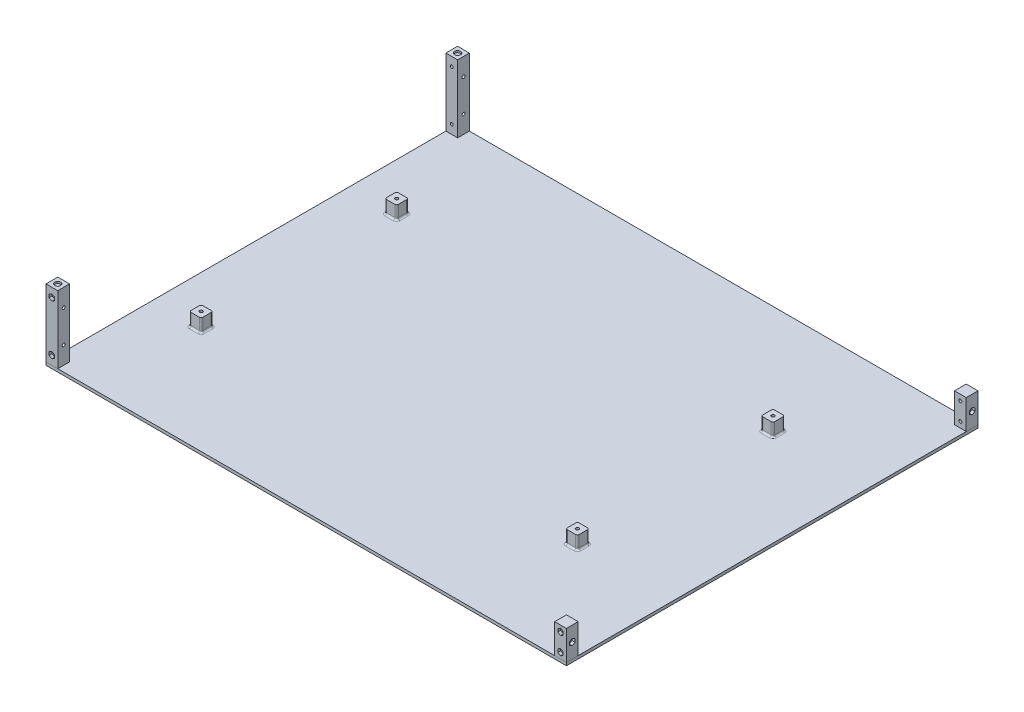
from build123d import *

# Parameters (mm, degrees)
SKETCH1_W            = 885
SKETCH1_H            = 700
BOSS_EXTRUDE1_DEPTH  = 5
SKETCH2_R            = 2.65
BOSS_EXTRUDE2_DEPTH  = 22.5
SKETCH4_R            = 5
CUT_EXTRUDE1_DEPTH   = 30
FILLET1_R            = 3
SKETCH5_W            = 20
SKETCH5_H            = 20
BOSS_EXTRUDE3_DEPTH  = 115
SKETCH6_W            = 20
SKETCH6_H            = 20
BOSS_EXTRUDE4_DEPTH  = 50
SKETCH7_R            = 2.5
CUT_EXTRUDE2_DEPTH   = 50
CUT_EXTRUDE3_START   = -5
SKETCH8_R            = 2.5
CUT_EXTRUDE3_DEPTH   = 5
LPATTERN1_COUNT      = 2
LPATTERN1_PITCH      = 55
LPATTERN2_COUNT      = 2
LPATTERN2_PITCH      = 680
LPATTERN2_COUNT_DIR2 = 2
LPATTERN2_PITCH_DIR2 = 55
CUT_EXTRUDE4_REACH   = 1136.736
SKETCH9_R            = 2.5
SKETCH10_R           = 2.5
CUT_EXTRUDE5_DEPTH   = 5
SKETCH11_R           = 2.65
CUT_EXTRUDE6_DEPTH   = 20
SKETCH12_R           = 2.65
CUT_EXTRUDE7_DEPTH   = 20
CUT_EXTRUDE8_DEPTH   = 5
CUT_EXTRUDE9_DEPTH   = 5
SKETCH15_R           = 5.1
CUT_EXTRUDE10_DEPTH  = 3.2


with BuildPart() as part:
    # Sketch1 → Boss-Extrude1 (new body)
    with BuildSketch(Plane(origin=(0, 0, 0), x_dir=(1, 0, 0), z_dir=(0, 1, 0))):
        with Locations((442.5, 350)):
            Rectangle(SKETCH1_W, SKETCH1_H)
    extrude(amount=BOSS_EXTRUDE1_DEPTH)

    # Sketch2 → Boss-Extrude2 (add)
    # profile 1 of 4: a face of its own
    with BuildSketch(Plane(origin=(0, 5, 0), x_dir=(1, 0, 0), z_dir=(0, 1, 0))):
        with BuildLine():
            Line((710, 523.25), (710, 509.25))
            ThreePointArc((710, 509.25), (710.878679656, 507.128679656), (713, 506.25))
            Line((713, 506.25), (727, 506.25))
            ThreePointArc((727, 506.25), (729.121320344, 507.128679656), (730, 509.25))
            Line((730, 509.25), (730, 523.25))
            ThreePointArc((730, 523.25), (729.121320344, 525.371320344), (727, 526.25))
            Line((727, 526.25), (713, 526.25))
            ThreePointArc((713, 526.25), (710.878679656, 525.371320344), (710, 523.25))
        make_face()
        with Locations((720, 516.25)):
            Circle(SKETCH2_R, mode=Mode.SUBTRACT)
    # profile 2 of 4: a face of its own
    with BuildSketch(Plane(origin=(0, 5, 0), x_dir=(1, 0, 0), z_dir=(0, 1, 0))):
        with BuildLine():
            Line((727, 193.75), (720, 193.75))
            Line((720, 193.75), (713, 193.75))
            ThreePointArc((713, 193.75), (710.878679656, 192.871320344), (710, 190.75))
            Line((710, 190.75), (710, 176.75))
            ThreePointArc((710, 176.75), (710.878679656, 174.628679656), (713, 173.75))
            Line((713, 173.75), (727, 173.75))
            ThreePointArc((727, 173.75), (729.121320344, 174.628679656), (730, 176.75))
            Line((730, 176.75), (730, 190.75))
            ThreePointArc((730, 190.75), (729.121320344, 192.871320344), (727, 193.75))
        make_face()
        with Locations((720, 183.75)):
            Circle(SKETCH2_R, mode=Mode.SUBTRACT)
    # profile 3 of 4: a face of its own
    with BuildSketch(Plane(origin=(0, 5, 0), x_dir=(1, 0, 0), z_dir=(0, 1, 0))):
        with BuildLine():
            Line((87, 193.75), (80, 193.75))
            Line((80, 193.75), (73, 193.75))
            ThreePointArc((73, 193.75), (70.878679656, 192.871320344), (70, 190.75))
            Line((70, 190.75), (70, 176.75))
            ThreePointArc((70, 176.75), (70.878679656, 174.628679656), (73, 173.75))
            Line((73, 173.75), (87, 173.75))
            ThreePointArc((87, 173.75), (89.121320344, 174.628679656), (90, 176.75))
            Line((90, 176.75), (90, 190.75))
            ThreePointArc((90, 190.75), (89.121320344, 192.871320344), (87, 193.75))
        make_face()
        with Locations((80, 183.75)):
            Circle(SKETCH2_R, mode=Mode.SUBTRACT)
    # profile 4 of 4: a face of its own
    with BuildSketch(Plane(origin=(0, 5, 0), x_dir=(1, 0, 0), z_dir=(0, 1, 0))):
        with BuildLine():
            Line((90, 509.25), (90, 523.25))
            ThreePointArc((90, 523.25), (89.121320344, 525.371320344), (87, 526.25))
            Line((87, 526.25), (73, 526.25))
            ThreePointArc((73, 526.25), (70.878679656, 525.371320344), (70, 523.25))
            Line((70, 523.25), (70, 509.25))
            ThreePointArc((70, 509.25), (70.878679656, 507.128679656), (73, 506.25))
            Line((73, 506.25), (87, 506.25))
            ThreePointArc((87, 506.25), (89.121320344, 507.128679656), (90, 509.25))
        make_face()
        with Locations((80, 516.25)):
            Circle(SKETCH2_R, mode=Mode.SUBTRACT)
    extrude(amount=BOSS_EXTRUDE2_DEPTH)

    # Sketch4 → Cut-Extrude1 (cut)
    with BuildSketch(Plane(origin=(0, 5, 0), x_dir=(1, 0, 0), z_dir=(0, 1, 0))):
        with Locations((80, 516.25)):
            Circle(SKETCH4_R)
        with Locations((720, 516.25)):
            Circle(SKETCH4_R)
        with Locations((720, 183.75)):
            Circle(SKETCH4_R)
        with Locations((80, 183.75)):
            Circle(SKETCH4_R)
    extrude(amount=-CUT_EXTRUDE1_DEPTH, mode=Mode.SUBTRACT)

    # Fillet1
    fillet1_edges = [part.edges().sort_by_distance(p)[0] for p in [
        (710.878679656, 5, -192.871320344),
        (720, 5, -193.75),
        (729.121320344, 5, -192.871320344),
        (730, 5, -183.75),
        (729.121320344, 5, -174.628679656),
        (720, 5, -173.75),
        (710.878679656, 5, -174.628679656),
        (710.878679656, 5, -525.371320344),
        (720, 5, -526.25),
        (729.121320344, 5, -525.371320344),
        (730, 5, -516.25),
        (729.121320344, 5, -507.128679656),
        (720, 5, -506.25),
        (710.878679656, 5, -507.128679656),
        (70.878679656, 5, -525.371320344),
        (80, 5, -526.25),
        (89.121320344, 5, -525.371320344),
        (90, 5, -516.25),
        (89.121320344, 5, -507.128679656),
        (80, 5, -506.25),
        (70.878679656, 5, -507.128679656),
        (70.878679656, 5, -192.871320344),
        (80, 5, -193.75),
        (89.121320344, 5, -192.871320344),
        (90, 5, -183.75),
        (89.121320344, 5, -174.628679656),
        (80, 5, -173.75),
        (70.878679656, 5, -174.628679656),
        (710, 5, -183.75),
        (710, 5, -516.25),
        (70, 5, -516.25),
        (70, 5, -183.75),
    ]]
    fillet(fillet1_edges, radius=FILLET1_R)

    # Sketch5 → Boss-Extrude3 (add)
    with BuildSketch(Plane(origin=(0, 5, 0), x_dir=(1, 0, 0), z_dir=(0, 1, 0))):
        with Locations((10, 10)):
            Rectangle(SKETCH5_W, SKETCH5_H)
        with Locations((10, 690)):
            Rectangle(SKETCH5_W, SKETCH5_H)
    extrude(amount=BOSS_EXTRUDE3_DEPTH)

    # Sketch6 → Boss-Extrude4 (add)
    with BuildSketch(Plane(origin=(0, 5, 0), x_dir=(1, 0, 0), z_dir=(0, 1, 0))):
        with Locations((875, 10)):
            Rectangle(SKETCH6_W, SKETCH6_H)
        with Locations((875, 690)):
            Rectangle(SKETCH6_W, SKETCH6_H)
    extrude(amount=BOSS_EXTRUDE4_DEPTH)

    # Sketch7 → Cut-Extrude2 (cut)
    with BuildSketch(Plane(origin=(20, 0, 0), x_dir=(0, 0, -1), z_dir=(1, 0, 0))):
        with Locations((10, 90)):
            Circle(SKETCH7_R)
        with Locations((10, 35)):
            Circle(SKETCH7_R)
    cut_extrude2 = extrude(amount=-CUT_EXTRUDE2_DEPTH, mode=Mode.SUBTRACT)

    # Sketch8 → Cut-Extrude3 (cut)
    with BuildSketch(Plane.ZY.offset(CUT_EXTRUDE3_START)):
        Polygon((-10, 84.630642497), (-5.35, 87.315321248), (-5.35, 92.684678752), (-10, 95.369357503), (-14.65, 92.684678752), (-14.65, 87.315321248), align=None)
        with Locations((-10, 90)):
            Circle(SKETCH8_R, mode=Mode.SUBTRACT)
    cut_extrude3 = extrude(amount=CUT_EXTRUDE3_DEPTH, mode=Mode.SUBTRACT)

    # LPattern1: Cut-Extrude3 ×2
    with Locations(*[(0, -i * LPATTERN1_PITCH, 0) for i in range(1, LPATTERN1_COUNT)]):
        add(cut_extrude3, mode=Mode.SUBTRACT)

    # LPattern2: Cut-Extrude2, Cut-Extrude3 2 × 2
    with Locations(*[(0, -j * LPATTERN2_PITCH_DIR2, -i * LPATTERN2_PITCH) for i in range(LPATTERN2_COUNT) for j in range(LPATTERN2_COUNT_DIR2) if (i, j) != (0, 0)]):
        add(cut_extrude2, mode=Mode.SUBTRACT)
        add(cut_extrude3, mode=Mode.SUBTRACT)

    # Sketch9 → Cut-Extrude4 (cut, up to next)
    with BuildSketch(Plane.XY, mode=Mode.PRIVATE) as cut_extrude4_sk1:
        with Locations((10, 105)):
            Circle(SKETCH9_R)
    cut_extrude4_tool1 = extrude(cut_extrude4_sk1.sketch, amount=-CUT_EXTRUDE4_REACH, mode=Mode.PRIVATE) & part.part
    # Sketch9 → Cut-Extrude4 (cut, up to next)
    with BuildSketch(Plane.XY, mode=Mode.PRIVATE) as cut_extrude4_sk2:
        with Locations((10, 20)):
            Circle(SKETCH9_R)
    cut_extrude4_tool2 = extrude(cut_extrude4_sk2.sketch, amount=-CUT_EXTRUDE4_REACH, mode=Mode.PRIVATE) & part.part
    cut_extrude4_1 = cut_extrude4_tool1.solids().sort_by_distance((10, 105, 0))[0]
    add(cut_extrude4_1, mode=Mode.SUBTRACT)
    cut_extrude4_2 = cut_extrude4_tool2.solids().sort_by_distance((10, 20, 0))[0]
    add(cut_extrude4_2, mode=Mode.SUBTRACT)
    cut_extrude4 = cut_extrude4_1 + cut_extrude4_2  # Cut-Extrude4 as one shape, for the pattern or mirror that repeats it

    # Sketch10 → Cut-Extrude5 (cut)
    # profile 1 of 2: a face of its own
    with BuildSketch(Plane.XY):
        Polygon((10, 99.630642497), (14.65, 102.315321248), (14.65, 107.684678752), (10, 110.369357503), (5.35, 107.684678752), (5.35, 102.315321248), align=None)
    # profile 2 of 2: a face of its own
    with BuildSketch(Plane.XY):
        Polygon((10, 14.630642497), (14.65, 17.315321248), (14.65, 22.684678752), (10, 25.369357503), (5.35, 22.684678752), (5.35, 17.315321248), align=None)
        with Locations((10, 20)):
            Circle(SKETCH10_R, mode=Mode.SUBTRACT)
    cut_extrude5 = extrude(amount=-CUT_EXTRUDE5_DEPTH, mode=Mode.SUBTRACT)

    # Mirror1: Cut-Extrude4, Cut-Extrude5 across plane
    add(cut_extrude4.mirror(Plane(origin=(0, 0, -350), x_dir=(1, 0, 0), z_dir=(0, 0, -1))), mode=Mode.SUBTRACT)
    add(cut_extrude5.mirror(Plane(origin=(0, 0, -350), x_dir=(1, 0, 0), z_dir=(0, 0, -1))), mode=Mode.SUBTRACT)

    # Sketch11 → Cut-Extrude6 (cut)
    with BuildSketch(Plane(origin=(0, 0, -20), x_dir=(-1, 0, 0), z_dir=(0, 0, -1))):
        with Locations((-875, 45)):
            Circle(SKETCH11_R)
        with Locations((-875, 15)):
            Circle(SKETCH11_R)
    cut_extrude6 = extrude(amount=-CUT_EXTRUDE6_DEPTH, mode=Mode.SUBTRACT)

    # Sketch12 → Cut-Extrude7 (cut)
    with BuildSketch(Plane.ZY.offset(-865)):
        with Locations((-10, 30)):
            Circle(SKETCH12_R)
    cut_extrude7 = extrude(amount=-CUT_EXTRUDE7_DEPTH, mode=Mode.SUBTRACT)

    # Sketch13 → Cut-Extrude8 (cut)
    with BuildSketch(Plane.XY):
        Polygon((875, 39.630642497), (879.65, 42.315321248), (879.65, 47.684678752), (875, 50.369357503), (870.35, 47.684678752), (870.35, 42.315321248), align=None)
        Polygon((875, 9.630642497), (879.65, 12.315321248), (879.65, 17.684678752), (875, 20.369357503), (870.35, 17.684678752), (870.35, 12.315321248), align=None)
    cut_extrude8 = extrude(amount=-CUT_EXTRUDE8_DEPTH, mode=Mode.SUBTRACT)

    # Sketch14 → Cut-Extrude9 (cut)
    with BuildSketch(Plane(origin=(885, 0, 0), x_dir=(0, 0, -1), z_dir=(1, 0, 0))):
        Polygon((10, 24.630642497), (14.65, 27.315321248), (14.65, 32.684678752), (10, 35.369357503), (5.35, 32.684678752), (5.35, 27.315321248), align=None)
    cut_extrude9 = extrude(amount=-CUT_EXTRUDE9_DEPTH, mode=Mode.SUBTRACT)

    # Mirror2: Cut-Extrude6, Cut-Extrude7, Cut-Extrude8, Cut-Extrude9 across plane
    add(cut_extrude6.mirror(Plane(origin=(0, 0, -350), x_dir=(1, 0, 0), z_dir=(0, 0, -1))), mode=Mode.SUBTRACT)
    add(cut_extrude7.mirror(Plane(origin=(0, 0, -350), x_dir=(1, 0, 0), z_dir=(0, 0, -1))), mode=Mode.SUBTRACT)
    add(cut_extrude8.mirror(Plane(origin=(0, 0, -350), x_dir=(1, 0, 0), z_dir=(0, 0, -1))), mode=Mode.SUBTRACT)
    add(cut_extrude9.mirror(Plane(origin=(0, 0, -350), x_dir=(1, 0, 0), z_dir=(0, 0, -1))), mode=Mode.SUBTRACT)

    # Sketch15 → Cut-Extrude10 (cut)
    with BuildSketch(Plane(origin=(0, 120, 0), x_dir=(1, 0, 0), z_dir=(0, 1, 0))):
        with Locations((10, 10)):
            Circle(SKETCH15_R)
    cut_extrude10 = extrude(amount=-CUT_EXTRUDE10_DEPTH, mode=Mode.SUBTRACT)

    # Mirror3: Cut-Extrude10 across plane
    add(cut_extrude10.mirror(Plane.XY.offset(-350)), mode=Mode.SUBTRACT)


with BuildPart() as body_2:
    # Split1: the piece on the far side of the plane
    add(part.part)
    split(bisect_by=Plane(origin=(0, 5, 0), x_dir=(0, 0, -1), z_dir=(0, -1, 0)), keep=Keep.BOTTOM)


with BuildPart() as part_1:
    add(part.part)

    # Split1
    split(bisect_by=Plane(origin=(0, 5, 0), x_dir=(0, 0, -1), z_dir=(0, -1, 0)), keep=Keep.TOP)


solid = Compound([body_2.part, part_1.part])
